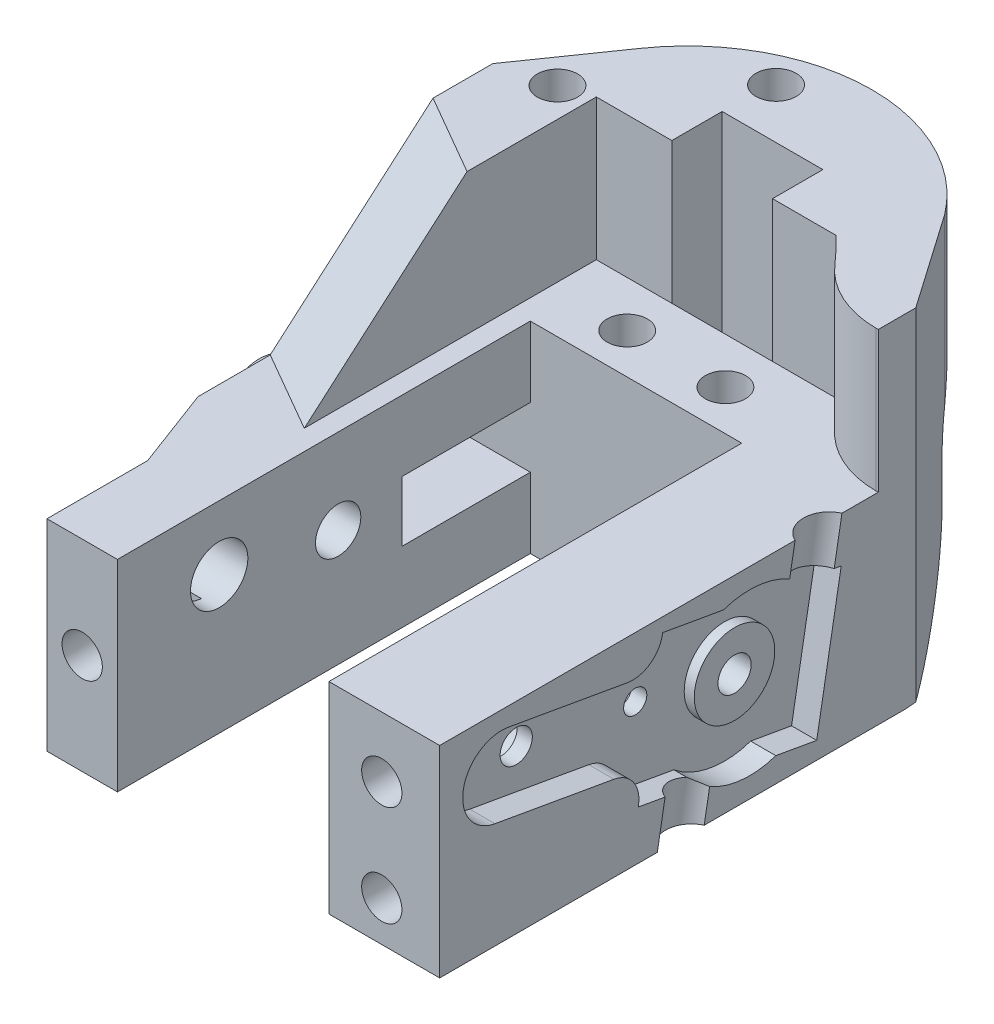
from build123d import *

# Parameters (mm, degrees)
BOSS_EXTRUDE1_DEPTH             = 20
SKETCH6_W                       = 25
SKETCH6_H                       = 20
BOSS_EXTRUDE5_DEPTH             = 5.5
BOSS_EXTRUDE11_START            = -20
BOSS_EXTRUDE11_DEPTH            = 34
SKETCH4_R                       = 2
CUT_EXTRUDE1_DEPTH              = 10
BOSS_EXTRUDE13_DEPTH            = 12
FILLET11_START                  = 14.0499999
FILLET11_DEPTH                  = 7.9500001
FILLET11_START_2                = -14.996842371
FILLET11_2_DEPTH                = 30.996842371
CHAMFER1_SIZE                   = 14
SKETCH26_W                      = 22
SKETCH26_H                      = 20
BOSS_EXTRUDE14_DEPTH            = 11
CUT_EXTRUDE7_DEPTH              = 2.5
CUT_EXTRUDE8_REACH              = 65.92
SKETCH27_R                      = 4
SKETCH27_R_2                    = 1.15
SKETCH27_R_3                    = 1.6
CUT_EXTRUDE9_DEPTH              = 2.5
CUT_EXTRUDE10_REACH             = 50.596
SKETCH29_R                      = 2.5
CUT_EXTRUDE11_REACH             = 55.607
SKETCH30_R                      = 2.5
BOSS_EXTRUDE15_DEPTH            = 1
BOSS_EXTRUDE15_DEPTH_BACK       = 2
SKETCH31_R                      = 4
SKETCH31_R_2                    = 1.65
SKETCH32_R                      = 2.85
SKETCH32_R_2                    = 2.25
CUT_EXTRUDE12_DEPTH             = 7
CUT_EXTRUDE12_DIRECTION_2_REACH = 61.046
SKETCH33_R                      = 3.8
BOSS_EXTRUDE17_DEPTH            = 7
FILLET17_R                      = 1
CUT_EXTRUDE13_DEPTH             = 14
SKETCH36_R                      = 2
CUT_EXTRUDE14_DEPTH             = 10
FILLET18_R                      = 10
CUT_EXTRUDE16_REACH             = 67.49
SKETCH37_W                      = 5.717933373
SKETCH37_H                      = 6
CHAMFER2_SIZE                   = 7
SKETCH38_W                      = 10
SKETCH38_H                      = 20
CUT_EXTRUDE17_DEPTH             = 4
CUT_EXTRUDE19_REACH             = 59.527
SKETCH39_W                      = 10
SKETCH39_H                      = 5
CUT_EXTRUDE20_DEPTH             = 112.274986141
CUT_EXTRUDE20_DEPTH_BACK        = 112.274986141
SKETCH40_W                      = 63.577932813
SKETCH40_H                      = 85.383198243
SKETCH41_R                      = 2
CUT_EXTRUDE21_DEPTH             = 8
FILLET19_R                      = 3


with BuildPart() as part:
    # Sketch1 → Boss-Extrude1 (new body)
    with BuildSketch(Plane(origin=(0, 0, 0), x_dir=(1, 0, 0), z_dir=(0, 1, 0))):
        Polygon((-15.5, -37), (-10, -37), (-10, 4), (11, 4), (11, -37), (18, -37), (18, -27), (21, -19), (21, 10), (-15.5, 10), align=None)
    extrude(amount=BOSS_EXTRUDE1_DEPTH)

    # Sketch6 → Boss-Extrude5 (add)
    with BuildSketch(Plane.ZY.offset(15.5)):
        with Locations((2.5, 10)):
            Rectangle(SKETCH6_W, SKETCH6_H)
    extrude(amount=BOSS_EXTRUDE5_DEPTH)

    # Sketch20 → Boss-Extrude11 (add)
    with BuildSketch(Plane(origin=(0, 20, 0), x_dir=(1, 0, 0), z_dir=(0, 1, 0)).offset(BOSS_EXTRUDE11_START)):
        Polygon((-21, 6.554166437), (13, 6.554166437), (13, -16.445833563), (21.006315459, -11.823385178), (21.006315459, 10.282066627), (15.003157729, 18.901571597), (-14.996842271, 18.901571597), (-21, 10.282066627), align=None)
    extrude(amount=BOSS_EXTRUDE11_DEPTH)

    # Sketch4 → Cut-Extrude1 (cut)
    with BuildSketch(Plane(origin=(0, 20, 0), x_dir=(1, 0, 0), z_dir=(0, 1, 0))):
        with Locations(Location((-4.375, 8, 0), (0, 0, 270))):
            Circle(SKETCH4_R)
        with Locations(Location((5.375, 8, 0), (0, 0, 270))):
            Circle(SKETCH4_R)
    extrude(amount=-CUT_EXTRUDE1_DEPTH, mode=Mode.SUBTRACT)

    # Sketch24 → Boss-Extrude13 (add)
    with BuildSketch(Plane(origin=(0, 34, 0), x_dir=(1, 0, 0), z_dir=(0, 1, 0))):
        with BuildLine():
            Line((-14.996842271, 18.901571597), (-14.420936492, 19.728473528))
            ThreePointArc((-14.420936492, 19.728473528), (-3.81756267, 26.467738085), (8.613124034, 24.643662635))
            ThreePointArc((8.613124034, 24.643662635), (12.140366622, 22.142331504), (15.003157729, 18.901571597))
            Line((15.003157729, 18.901571597), (21.006315459, 10.282066627))
            Line((21.006315459, 10.282066627), (21.006315459, 6.554166437))
            Line((21.006315459, 6.554166437), (-21, 6.554166437))
            Line((-21, 6.554166437), (-21, 10.282066627))
            Line((-21, 10.282066627), (-14.996842271, 18.901571597))
        make_face()
    extrude(amount=-BOSS_EXTRUDE13_DEPTH)

    # Fillet11: read off the stored shape, not the designer's step
    # Fillet11 outline → Fillet11 (add)
    with BuildSketch(Plane(origin=(0, 0, 0), x_dir=(1, 0, 0), z_dir=(0, 1, 0)).offset(FILLET11_START)):
        with BuildLine():
            Line((-14.996842271, 18.901571597), (15.003161757, 18.901565813))
            ThreePointArc((15.003161757, 18.901565813), (12.140369243, 22.142329149), (8.613124034, 24.643662635))
            ThreePointArc((8.613124034, 24.643662635), (-3.81756267, 26.467738085), (-14.420936492, 19.728473528))
            Line((-14.420936492, 19.728473528), (-14.996842271, 18.901571597))
        make_face()
    extrude(amount=FILLET11_DEPTH)

    # Fillet11 2 outline → Fillet11 2 (cut)
    with BuildSketch(Plane.YZ.offset(FILLET11_START_2)):
        with BuildLine():
            Line((22, -28), (22, -26.851571597))
            ThreePointArc((22, -26.851571597), (19.67149891, -21.230072687), (14.05, -18.901571597))
            Line((14.05, -18.901571597), (14.0499999, -28))
            Line((14.0499999, -28), (22, -28))
        make_face()
    extrude(amount=FILLET11_2_DEPTH, mode=Mode.SUBTRACT)

    # Chamfer1
    chamfer1_edges = [part.edges().sort_by_distance(p)[0] for p in [
        (17.003157729, 34, 14.134609371),
    ]]
    chamfer(chamfer1_edges, length=CHAMFER1_SIZE)

    # Sketch26 → Boss-Extrude14 (add)
    with BuildSketch(Plane.ZY.offset(21)):
        with Locations((26, 10)):
            Rectangle(SKETCH26_W, SKETCH26_H)
    extrude(amount=-BOSS_EXTRUDE14_DEPTH)

    # Sketch25 → Cut-Extrude7 (cut)
    with BuildSketch(Plane.ZY.offset(21)):
        with BuildLine():
            Line((12.437601752, 15.031473467), (30.16524051, 18.157334485))
            ThreePointArc((30.16524051, 18.157334485), (34.654257241, 15.01409113), (31.511013887, 10.525074399))
            Line((31.511013887, 10.525074399), (13.783375129, 7.399213382))
            ThreePointArc((13.783375129, 7.399213382), (-1.660528651, 8.610814579), (12.437601752, 15.031473467))
        make_face()
    extrude(amount=-CUT_EXTRUDE7_DEPTH, mode=Mode.SUBTRACT)

    # Sketch27 → Cut-Extrude8 (cut, up to next)
    with BuildSketch(Plane.ZY.offset(18.5), mode=Mode.PRIVATE) as cut_extrude8_sk1:
        with Locations((6.217933373, 10)):
            Circle(SKETCH27_R)
    cut_extrude8_tool1 = extrude(cut_extrude8_sk1.sketch, amount=-CUT_EXTRUDE8_REACH, mode=Mode.PRIVATE) & part.part
    # Sketch27 → Cut-Extrude8 (cut, up to next)
    with BuildSketch(Plane.ZY.offset(18.5), mode=Mode.PRIVATE) as cut_extrude8_sk2:
        with Locations((15.08120315, 11.562833599)):
            Circle(SKETCH27_R_2)
    cut_extrude8_tool2 = extrude(cut_extrude8_sk2.sketch, amount=-CUT_EXTRUDE8_REACH, mode=Mode.PRIVATE) & part.part
    # Sketch27 → Cut-Extrude8 (cut, up to next)
    with BuildSketch(Plane.ZY.offset(18.5), mode=Mode.PRIVATE) as cut_extrude8_sk3:
        with Locations((26.898896186, 13.646611731)):
            Circle(SKETCH27_R_3)
    cut_extrude8_tool3 = extrude(cut_extrude8_sk3.sketch, amount=-CUT_EXTRUDE8_REACH, mode=Mode.PRIVATE) & part.part
    add(cut_extrude8_tool1.solids().sort_by_distance((-18.5, 10, 6.217933))[0], mode=Mode.SUBTRACT)
    add(cut_extrude8_tool2.solids().sort_by_distance((-18.5, 11.562834, 15.081203))[0], mode=Mode.SUBTRACT)
    add(cut_extrude8_tool3.solids().sort_by_distance((-18.5, 13.646612, 26.898896))[0], mode=Mode.SUBTRACT)

    # Sketch28 → Cut-Extrude9 (cut)
    with BuildSketch(Plane.ZY.offset(21)):
        Polygon((-2.876065895, 15.50446885), (14.85047366, 18.630136048), (17.281548147, 4.842827506), (-0.444991407, 1.717160308), align=None)
    extrude(amount=-CUT_EXTRUDE9_DEPTH, mode=Mode.SUBTRACT)

    # Cut-Extrude10: up to this plane
    cut_extrude10_end = Plane(origin=(0, 20, 0), z_dir=(0, -1, 0))
    # Sketch29 → Cut-Extrude10 (cut, up to the surface)
    with BuildSketch(Plane(origin=(0, 15.528788143, -2.738144327), x_dir=(1, 0, 0), z_dir=(0, -0.9848077530122088, 0.17364817766692708)), mode=Mode.PRIVATE) as cut_extrude10_sk1:
        with Locations((-22, 2.85995077)):
            Circle(SKETCH29_R)
    cut_extrude10_tool1 = split(extrude(cut_extrude10_sk1.sketch, amount=-CUT_EXTRUDE10_REACH, mode=Mode.PRIVATE), bisect_by=cut_extrude10_end, keep=Keep.BOTH, mode=Mode.PRIVATE)
    add(cut_extrude10_tool1.solids().sort_by_distance((-22, 16.025413, 0.078357))[0], mode=Mode.SUBTRACT)

    # Cut-Extrude11: up to this plane
    cut_extrude11_end = Plane(origin=(0, 0, 0), z_dir=(0, -1, 0))
    # Sketch30 → Cut-Extrude11 (cut, up to the surface)
    with BuildSketch(Plane(origin=(0, 1.741479601, -0.30706984), x_dir=(1, 0, 0), z_dir=(0, 0.9848077530122086, -0.17364817766692728)), mode=Mode.PRIVATE) as cut_extrude11_sk1:
        with Locations((-22, -12.85995077)):
            Circle(SKETCH30_R)
    cut_extrude11_tool1 = split(extrude(cut_extrude11_sk1.sketch, amount=-CUT_EXTRUDE11_REACH, mode=Mode.PRIVATE), bisect_by=cut_extrude11_end, keep=Keep.BOTH, mode=Mode.PRIVATE)
    add(cut_extrude11_tool1.solids().sort_by_distance((-22, 3.974587, 12.357509))[0], mode=Mode.SUBTRACT)

    # Sketch31 → Boss-Extrude15 (add, two sides: drawn at the far end of the back side and taken through both)
    with BuildSketch(Plane.ZY.offset(18.5).offset(-BOSS_EXTRUDE15_DEPTH_BACK)):
        with Locations((6.217933373, 10)):
            Circle(SKETCH31_R)
        with Locations((6.217933373, 10)):
            Circle(SKETCH31_R_2, mode=Mode.SUBTRACT)
    extrude(amount=BOSS_EXTRUDE15_DEPTH + BOSS_EXTRUDE15_DEPTH_BACK)

    # Sketch32 → Cut-Extrude12 (cut)
    with BuildSketch(Plane(origin=(-10, 0, 0), x_dir=(0, 0, -1), z_dir=(1, 0, 0))):
        with Locations((-26.898896186, 13.646611731)):
            Circle(SKETCH32_R)
        with Locations((-15.08120315, 11.562833599)):
            Circle(SKETCH32_R_2)
    extrude(amount=-CUT_EXTRUDE12_DEPTH, mode=Mode.SUBTRACT)

    # Sketch32 → Cut-Extrude12 direction 2 (cut, up to next)
    with BuildSketch(Plane(origin=(-10, 0, 0), x_dir=(0, 0, -1), z_dir=(1, 0, 0)), mode=Mode.PRIVATE) as cut_extrude12_direction_2_sk1:
        with Locations((-26.898896186, 13.646611731)):
            Circle(SKETCH32_R)
    cut_extrude12_direction_2_tool1 = extrude(cut_extrude12_direction_2_sk1.sketch, amount=CUT_EXTRUDE12_DIRECTION_2_REACH, mode=Mode.PRIVATE) & part.part
    # Sketch32 → Cut-Extrude12 direction 2 (cut, up to next)
    with BuildSketch(Plane(origin=(-10, 0, 0), x_dir=(0, 0, -1), z_dir=(1, 0, 0)), mode=Mode.PRIVATE) as cut_extrude12_direction_2_sk2:
        with Locations((-15.08120315, 11.562833599)):
            Circle(SKETCH32_R_2)
    cut_extrude12_direction_2_tool2 = extrude(cut_extrude12_direction_2_sk2.sketch, amount=CUT_EXTRUDE12_DIRECTION_2_REACH, mode=Mode.PRIVATE) & part.part
    add(cut_extrude12_direction_2_tool1.solids().sort_by_distance((-10, 13.646612, 26.898896))[0], mode=Mode.SUBTRACT)
    add(cut_extrude12_direction_2_tool2.solids().sort_by_distance((-10, 11.562834, 15.081203))[0], mode=Mode.SUBTRACT)

    # Sketch33 → Boss-Extrude17 (add)
    with BuildSketch(Plane(origin=(21.006315459, 0, 0), x_dir=(0, 0, -1), z_dir=(1, 0, 0))):
        with Locations((-6.217933373, 10)):
            Circle(SKETCH33_R)
    extrude(amount=BOSS_EXTRUDE17_DEPTH)

    # Fillet17
    fillet17_edges = [part.edges().sort_by_distance(p)[0] for p in [
        (28.006315459, 10, 10.017933373),
    ]]
    fillet(fillet17_edges, radius=FILLET17_R)

    # Sketch35 → Cut-Extrude13 (cut)
    with BuildSketch(Plane(origin=(0, 34, 0), x_dir=(1, 0, 0), z_dir=(0, 1, 0))):
        with BuildLine():
            Line((-20.79995418, 6.554166437), (13, 6.554166437))
            Line((13, 6.554166437), (13, 12.554166437))
            Line((13, 12.554166437), (-10.802737675, 12.554166437))
            ThreePointArc((-10.802737675, 12.554166437), (-12.071315957, 11.281715365), (-13.284990593, 9.95679406))
            ThreePointArc((-13.284990593, 9.95679406), (-16.675255632, 7.444453934), (-20.79995418, 6.554166437))
        make_face()
    extrude(amount=-CUT_EXTRUDE13_DEPTH, mode=Mode.SUBTRACT)

    # Sketch36 → Cut-Extrude14 (cut)
    with BuildSketch(Plane.XY.offset(37)):
        with Locations((-15.25, 14)):
            Circle(SKETCH36_R)
        with Locations((14.5, 10)):
            Circle(SKETCH36_R)
        with Locations((-15.25, 4)):
            Circle(SKETCH36_R)
    extrude(amount=-CUT_EXTRUDE14_DEPTH, mode=Mode.SUBTRACT)

    # Fillet18
    fillet18_edges = [part.edges().sort_by_distance(p)[0] for p in [
        (0.003157729, 0, -18.901571597),
    ]]
    fillet(fillet18_edges, radius=FILLET18_R)

    # Sketch37 → Cut-Extrude16 (cut, up to next)
    with BuildSketch(Plane(origin=(21, 0, 0), x_dir=(0, 0, -1), z_dir=(1, 0, 0)), mode=Mode.PRIVATE) as cut_extrude16_sk1:
        with Locations((1.141033313, 10)):
            Rectangle(SKETCH37_W, SKETCH37_H)
    cut_extrude16_tool1 = extrude(cut_extrude16_sk1.sketch, amount=-CUT_EXTRUDE16_REACH, mode=Mode.PRIVATE) & part.part
    add(cut_extrude16_tool1.solids().sort_by_distance((21, 10, -1.141033))[0], mode=Mode.SUBTRACT)

    # Chamfer2
    chamfer2_edges = [part.edges().sort_by_distance(p)[0] for p in [
        (11, 10, 1.717933373),
    ]]
    chamfer(chamfer2_edges, length=CHAMFER2_SIZE)

    # Sketch38 → Cut-Extrude17 (cut)
    with BuildSketch(Plane.XZ):
        with Locations((0.5, -14)):
            Rectangle(SKETCH38_W, SKETCH38_H)
    extrude(amount=-CUT_EXTRUDE17_DEPTH, mode=Mode.SUBTRACT)

    # Sketch39 → Cut-Extrude19 (cut, up to next)
    with BuildSketch(Plane(origin=(0, 34, 0), x_dir=(1, 0, 0), z_dir=(0, 1, 0)), mode=Mode.PRIVATE) as cut_extrude19_sk1:
        with Locations((0.5, 15.054166437)):
            Rectangle(SKETCH39_W, SKETCH39_H)
    cut_extrude19_tool1 = extrude(cut_extrude19_sk1.sketch, amount=-CUT_EXTRUDE19_REACH, mode=Mode.PRIVATE) & part.part
    add(cut_extrude19_tool1.solids().sort_by_distance((0.5, 34, -15.054166))[0], mode=Mode.SUBTRACT)


with BuildPart() as body_2:
    # Mirror1: mirrored copy
    add(part.part.mirror(Plane.ZY.offset(31)))

    # Sketch41 → Cut-Extrude21 (cut)
    with BuildSketch(Plane(origin=(0, 34, 0), x_dir=(1, 0, 0), z_dir=(0, 1, 0))):
        with Locations(Location((-67.110696208, 22.514658427, 0), (0, 0, 270))):
            Circle(SKETCH41_R)
        with Locations(Location((-77.910696208, 11.606522541, 0), (0, 0, 270))):
            Circle(SKETCH41_R)
    extrude(amount=-CUT_EXTRUDE21_DEPTH, mode=Mode.SUBTRACT)

    # Fillet19
    fillet19_edges = [body_2.edges().sort_by_distance(p)[0] for p in [
        (-42.25, 15.55261182, 15.393124215),
        (-42.25, 7.920351734, 16.738897592),
    ]]
    fillet(fillet19_edges, radius=FILLET19_R)


with BuildPart() as part_1:
    add(part.part)

    # Sketch40 → Cut-Extrude20 (cut, two sides: drawn at the far end of the back side and taken through both)
    with BuildSketch(Plane(origin=(0, 0, -18.901571597), x_dir=(-1, 0, 0), z_dir=(0, 0, -1)).offset(-CUT_EXTRUDE20_DEPTH_BACK)):
        with Locations((-5.368663992, 38.471473394)):
            Rectangle(SKETCH40_W, SKETCH40_H)
    extrude(amount=CUT_EXTRUDE20_DEPTH + CUT_EXTRUDE20_DEPTH_BACK, mode=Mode.SUBTRACT)


solid = body_2.part
